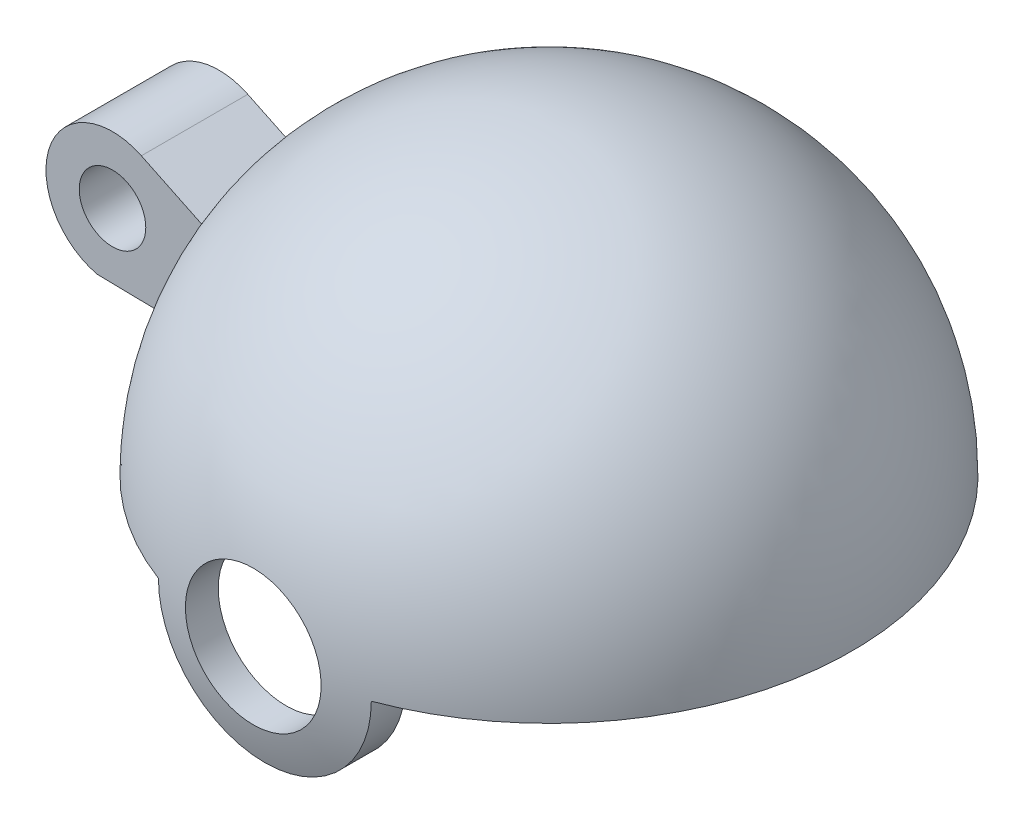
from build123d import *

# Parameters (mm, degrees)
BOSS_EXTRUDE2_START     = 2.54
SKETCH5_R               = 1.5875
BOSS_EXTRUDE2_DEPTH     = 5.08
CUT_EXTRUDE2_DEPTH      = 30.662861241
CUT_EXTRUDE2_DEPTH_BACK = 30.662861241
SKETCH7_R               = 3.2385
CUT_EXTRUDE3_DEPTH      = 30.485546588
CUT_EXTRUDE3_DEPTH_BACK = 30.485546588


with BuildPart() as part:
    # Sketch1 → Revolve1 (revolve)
    with BuildSketch(Plane.XY):
        with BuildLine():
            Line((0, 12.954), (0, 14.478))
            ThreePointArc((0, 14.478), (-14.478, 0), (0, -14.478))
            Line((0, -14.478), (0, -12.954))
            ThreePointArc((0, -12.954), (-12.954, 0), (0, 12.954))
        make_face()
    revolve(axis=Axis((0, 0, 0), (0, 1, 0)))

    # Sketch5 → Boss-Extrude2 (add)
    with BuildSketch(Plane.XY.offset(BOSS_EXTRUDE2_START)):
        with BuildLine():
            Line((-13.509869394, 4.51765424), (-13.755118472, 4.51765424))
            Line((-13.755118472, 4.51765424), (-16.91158996, 6.036139703))
            ThreePointArc((-16.91158996, 6.036139703), (-21.279157214, 4.239708186), (-19.028959124, 0.087670316))
            Line((-19.028959124, 0.087670316), (-14.478, 0))
            Line((-14.478, 0), (-14.232750922, 0))
            Line((-14.232750922, 0), (-13.509869394, 4.51765424))
        make_face()
        with Locations((-18.288, 3.175)):
            Circle(SKETCH5_R, mode=Mode.SUBTRACT)
    extrude(amount=-BOSS_EXTRUDE2_DEPTH)

    # Sketch7 → Cut-Extrude2 (cut, two sides: drawn at the far end of the back side and taken through both)
    with BuildSketch(Plane.XY.offset(-CUT_EXTRUDE2_DEPTH_BACK)):
        Circle(SKETCH7_R)
    extrude(amount=CUT_EXTRUDE2_DEPTH + CUT_EXTRUDE2_DEPTH_BACK, mode=Mode.SUBTRACT)

    # Sketch8 → Cut-Extrude3 (cut, two sides: drawn at the far end of the back side and taken through both)
    with BuildSketch(Plane.XY.offset(-CUT_EXTRUDE3_DEPTH_BACK)):
        with BuildLine():
            Line((-101.972979579, 0), (-14.478, 0))
            Line((-14.478, 0), (-5.08, 0))
            ThreePointArc((-5.08, 0), (0, -5.08), (5.08, 0))
            Line((5.08, 0), (14.478, 0))
            Line((14.478, 0), (101.972979579, 0))
            Line((101.972979579, 0), (101.972979579, -174.989959159))
            Line((101.972979579, -174.989959159), (-101.972979579, -174.989959159))
            Line((-101.972979579, -174.989959159), (-101.972979579, 0))
        make_face()
    extrude(amount=CUT_EXTRUDE3_DEPTH + CUT_EXTRUDE3_DEPTH_BACK, mode=Mode.SUBTRACT)


solid = part.part
